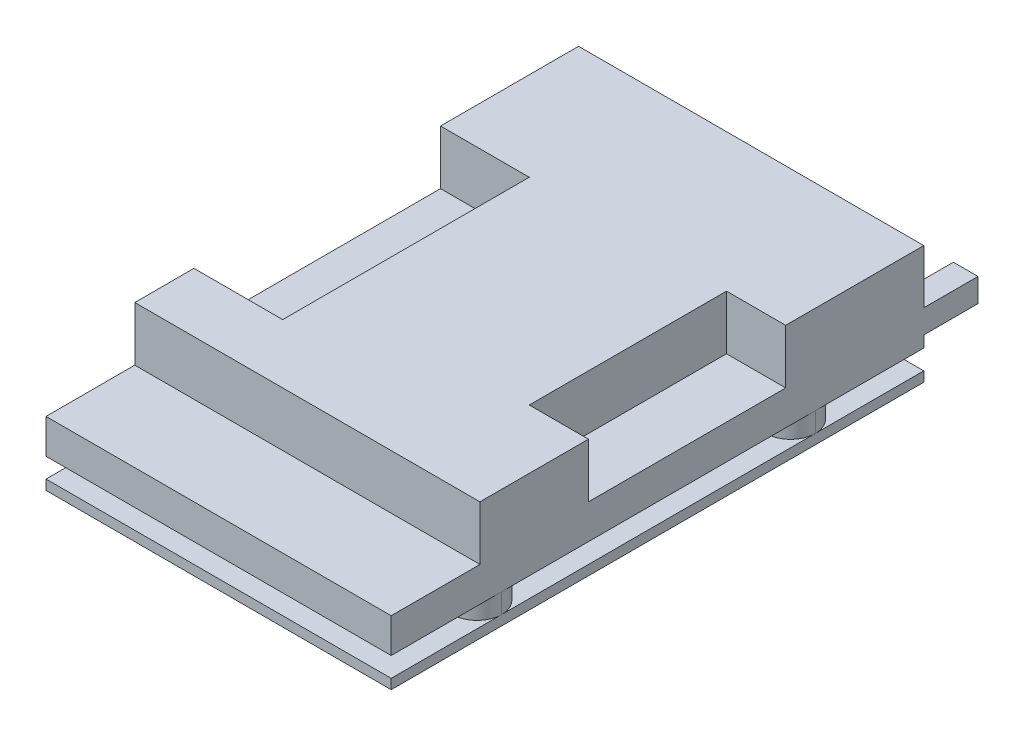
from build123d import *

# Parameters (mm, degrees)
SKETCH1_W               = 35
SKETCH1_H               = 54
BOSS_EXTRUDE1_DEPTH     = 12
SKETCH2_W               = 35
SKETCH2_H               = 9
SKETCH2_W_2             = 9
SKETCH2_H_2             = 25
SKETCH2_W_3             = 6
SKETCH2_H_3             = 20
CUT_EXTRUDE1_DEPTH      = 5.5
CUT_EXTRUDE2_DEPTH      = 59.019393309
CUT_EXTRUDE2_DEPTH_BACK = 59.019393309
SKETCH3_W               = 25
SKETCH3_H               = 2
CUT_EXTRUDE3_DEPTH      = 46.803929962
CUT_EXTRUDE3_DEPTH_BACK = 46.803929962
SKETCH4_W               = 8.5
SKETCH4_H               = 2
SKETCH4_W_2             = 26.8
SKETCH4_W_3             = 8.7
FILLET1_R               = 2.5
SKETCH5_W               = 2.5
SKETCH5_H               = 2.389297353
SKETCH5_W_2             = 1.629066377
SKETCH5_H_2             = 1.665267852
SKETCH5_W_3             = 1.411857527
SKETCH5_W_4             = 2.606506203
SKETCH5_H_3             = 1.918678177
BOSS_EXTRUDE2_DEPTH     = 5.5


with BuildPart() as part:
    # Sketch1 → Boss-Extrude1 (new body)
    with BuildSketch(Plane(origin=(0, 0, 0), x_dir=(1, 0, 0), z_dir=(0, 1, 0))):
        Rectangle(SKETCH1_W, SKETCH1_H)
    extrude(amount=BOSS_EXTRUDE1_DEPTH)

    # Sketch2 → Cut-Extrude1 (cut)
    with BuildSketch(Plane(origin=(0, 12, 0), x_dir=(1, 0, 0), z_dir=(0, 1, 0))):
        with Locations((0, -22.5)):
            Rectangle(SKETCH2_W, SKETCH2_H)
        with Locations((-13, 0.5)):
            Rectangle(SKETCH2_W_2, SKETCH2_H_2)
        with Locations((14.5, 3)):
            Rectangle(SKETCH2_W_3, SKETCH2_H_3)
    extrude(amount=-CUT_EXTRUDE1_DEPTH, mode=Mode.SUBTRACT)

    # Sketch3 → Cut-Extrude2 (cut, two sides: drawn at the far end of the back side and taken through both)
    with BuildSketch(Plane(origin=(0, 0, -27), x_dir=(-1, 0, 0), z_dir=(0, 0, -1)).offset(-CUT_EXTRUDE2_DEPTH_BACK)):
        with Locations((0, 2)):
            Rectangle(SKETCH3_W, SKETCH3_H)
    extrude(amount=CUT_EXTRUDE2_DEPTH + CUT_EXTRUDE2_DEPTH_BACK, mode=Mode.SUBTRACT)

    # Sketch4 → Cut-Extrude3 (cut, two sides: drawn at the far end of the back side and taken through both)
    with BuildSketch(Plane.ZY.offset(17.5).offset(-CUT_EXTRUDE3_DEPTH_BACK)):
        with Locations((-22.75, 2)):
            Rectangle(SKETCH4_W, SKETCH4_H)
        with Locations((-0.1, 2)):
            Rectangle(SKETCH4_W_2, SKETCH4_H)
        with Locations((22.65, 2)):
            Rectangle(SKETCH4_W_3, SKETCH4_H)
    extrude(amount=CUT_EXTRUDE3_DEPTH + CUT_EXTRUDE3_DEPTH_BACK, mode=Mode.SUBTRACT)

    # Fillet1
    fillet1_edges = [part.edges().sort_by_distance(p)[0] for p in [
        (12.5, 2, -13.5),
        (12.5, 2, -18.5),
        (17.5, 2, -18.5),
        (17.5, 2, -13.5),
        (12.5, 2, 13.3),
        (12.5, 2, 18.3),
        (17.5, 2, 13.3),
        (17.5, 2, 18.3),
        (-12.5, 2, 13.3),
        (-12.5, 2, 18.3),
        (-12.5, 2, -18.5),
        (-12.5, 2, -13.5),
        (-17.5, 2, 13.3),
        (-17.5, 2, 18.3),
        (-17.5, 2, -18.5),
        (-17.5, 2, -13.5),
    ]]
    fillet(fillet1_edges, radius=FILLET1_R - 0.0001)  # a hair under: the kernel refuses the full size

    # Sketch5 → Boss-Extrude2 (add)
    with BuildSketch(Plane(origin=(0, 0, -27), x_dir=(-1, 0, 0), z_dir=(0, 0, -1))):
        with Locations((-16.25, 5.345369084)):
            Rectangle(SKETCH5_W, SKETCH5_H)
        with Locations((-1.647167115, 5.236764658)):
            Rectangle(SKETCH5_W_2, SKETCH5_H_2)
        with Locations((4.688091019, 5.236764658)):
            Rectangle(SKETCH5_W_3, SKETCH5_H_2)
        with Locations((15.530432797, 5.110059495)):
            Rectangle(SKETCH5_W_4, SKETCH5_H_3)
    extrude(amount=BOSS_EXTRUDE2_DEPTH)


solid = part.part
